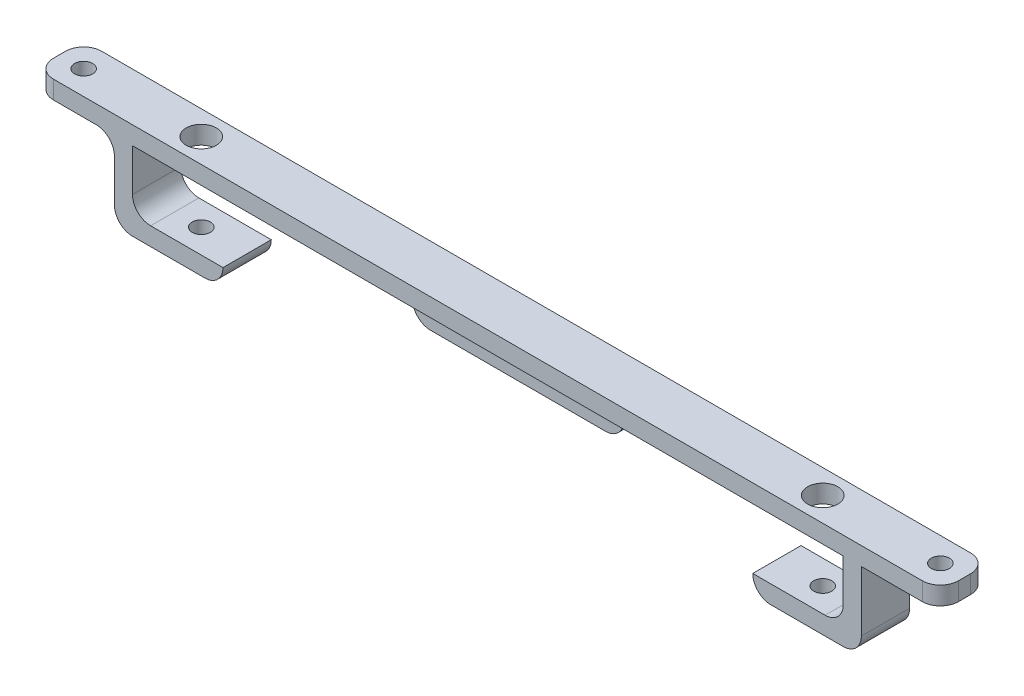
from build123d import *

# Parameters (mm, degrees)
BOSS_EXTRUDE1_DEPTH = 3
BOSS_EXTRUDE2_DEPTH = 4
SKETCH4_R           = 1.5
SKETCH4_R_2         = 2.5
CUT_EXTRUDE1_DEPTH  = 3
SKETCH5_R           = 1.5
CUT_EXTRUDE2_DEPTH  = 77.223356001
SKETCH6_W           = 35
SKETCH6_H           = 6.8
BOSS_EXTRUDE3_DEPTH = 3
FILLET1_R           = 3


with BuildPart() as part:
    # Sketch2 → Boss-Extrude1 (new body)
    with BuildSketch(Plane(origin=(0, 0, 0), x_dir=(1, 0, 0), z_dir=(0, 1, 0))):
        Polygon((-75, 4), (-75, -4), (75, -4), align=None)
        Polygon((75, 4), (75, -4), (-75, 4), align=None)
    extrude(amount=BOSS_EXTRUDE1_DEPTH)

    # Sketch3 → Boss-Extrude2 (add, symmetric)
    with BuildSketch(Plane.XY):
        Polygon((-58.9, 0), (-58.9, -10), (-43.9, -10), (-43.9, -13), (-61.9, -13), (-61.9, 0), align=None)
    boss_extrude2 = extrude(amount=BOSS_EXTRUDE2_DEPTH, both=True)

    # Sketch4 → Cut-Extrude1 (cut)
    with BuildSketch(Plane(origin=(0, 3, 0), x_dir=(1, 0, 0), z_dir=(0, 1, 0))):
        with Locations(Location((-71, 0, 0), (0, 0, 270))):
            Circle(SKETCH4_R)
        with Locations(Location((-51.5, 0, 0), (0, 0, 270))):
            Circle(SKETCH4_R_2)
    cut_extrude1 = extrude(amount=-CUT_EXTRUDE1_DEPTH, mode=Mode.SUBTRACT)

    # Sketch5 → Cut-Extrude2 (cut, through all)
    with BuildSketch(Plane(origin=(0, -10, 0), x_dir=(1, 0, 0), z_dir=(0, 1, 0))):
        with Locations(Location((-51.5, 0, 0), (0, 0, 270))):
            Circle(SKETCH5_R)
    cut_extrude2 = extrude(amount=-CUT_EXTRUDE2_DEPTH, mode=Mode.SUBTRACT)

    # Mirror1: Boss-Extrude2, Cut-Extrude1, Cut-Extrude2 across plane
    add(boss_extrude2.mirror(Plane(origin=(0, 0, 0), x_dir=(0, 0, 1), z_dir=(1, 0, 0))))
    add(cut_extrude1.mirror(Plane(origin=(0, 0, 0), x_dir=(0, 0, 1), z_dir=(1, 0, 0))), mode=Mode.SUBTRACT)
    add(cut_extrude2.mirror(Plane(origin=(0, 0, 0), x_dir=(0, 0, 1), z_dir=(1, 0, 0))), mode=Mode.SUBTRACT)

    # Sketch6 → Boss-Extrude3 (add)
    with BuildSketch(Plane(origin=(0, 0, -4), x_dir=(-1, 0, 0), z_dir=(0, 0, -1))):
        with Locations((0, -3.4)):
            Rectangle(SKETCH6_W, SKETCH6_H)
    extrude(amount=-BOSS_EXTRUDE3_DEPTH)

    # Fillet1
    fillet1_edges = [part.edges().sort_by_distance(p)[0] for p in [
        (-61.9, 0, 0),
        (-61.9, -13, 0),
        (-43.9, -13, 0),
        (-58.9, -10, 0),
        (58.9, -10, 0),
        (43.9, -13, 0),
        (61.9, -13, 0),
        (17.5, -6.8, -2.5),
        (0, 0, -1),
        (-17.5, -6.8, -2.5),
        (-75, 1.5, -4),
        (75, 1.5, -4),
        (75, 1.5, 4),
        (-75, 1.5, 4),
    ]]
    fillet(fillet1_edges, radius=FILLET1_R - 0.0001)  # a hair under: the kernel refuses the full size


solid = part.part
